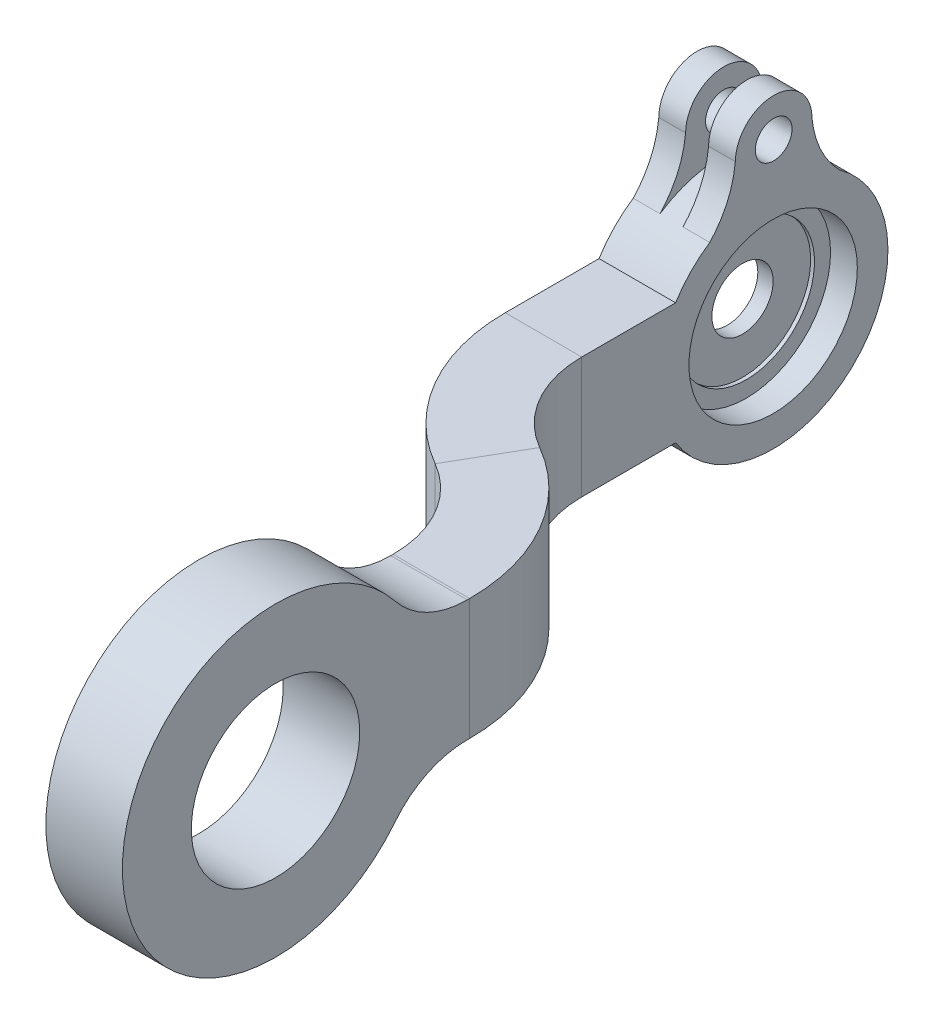
from build123d import *

# Parameters (mm, degrees)
CROQUIS2_W              = 10
CROQUIS2_H              = 15.834903248
CROQUIS4_R              = 15
SALIENTE_EXTRUIR1_DEPTH = 10
CROQUIS5_R              = 20
SALIENTE_EXTRUIR2_DEPTH = 10
SALIENTE_EXTRUIR5_DEPTH = 3.5
CROQUIS13_R             = 2.4
CORTAR_EXTRUIR1_DEPTH   = 10
CROQUIS7_R              = 11
CORTAR_EXTRUIR3_DEPTH   = 10
REDONDEO2_R             = 12
REDONDEO3_R             = 12
CROQUIS14_R             = 11
CORTAR_EXTRUIR4_DEPTH   = 4
CROQUIS6_R              = 4
CORTAR_EXTRUIR5_DEPTH   = 6
CORTAR_EXTRUIR6_START   = -4
CROQUIS15_R             = 11
CORTAR_EXTRUIR6_DEPTH   = 4
SALIENTE_EXTRUIR6_START = 0.5
CROQUIS16_R             = 11
CROQUIS16_R_2           = 8.9
SALIENTE_EXTRUIR6_DEPTH = 0.5


with BuildPart() as part:
    # Barrer1: sweep along a path in Croquis1
    with BuildLine(Plane(origin=(0, 0, 0), x_dir=(1, 0, 0), z_dir=(0, 1, 0))) as barrer1_path:
        Line((-20, 85), (-20, 60))
        ThreePointArc((-20, 60), (-17.320508076, 50), (-10, 42.679491924))
        ThreePointArc((-10, 42.679491924), (-2.679491924, 35.358983849), (0, 25.358983849))
        Line((0, 25.358983849), (0, 0))
    # Croquis2 → Barrer1 (sweep)
    with BuildSketch(Plane.XY):
        Rectangle(CROQUIS2_W, CROQUIS2_H)
    sweep(path=barrer1_path.line)

    # Croquis4 → Saliente-Extruir1 (add)
    with BuildSketch(Plane(origin=(-15, 0, 0), x_dir=(0, 0, -1), z_dir=(1, 0, 0))):
        with Locations((85, 0)):
            Circle(CROQUIS4_R)
    extrude(amount=-SALIENTE_EXTRUIR1_DEPTH)

    # Croquis5 → Saliente-Extruir2 (add)
    with BuildSketch(Plane(origin=(5, 0, 0), x_dir=(0, 0, -1), z_dir=(1, 0, 0))):
        Circle(CROQUIS5_R)
    extrude(amount=-SALIENTE_EXTRUIR2_DEPTH)

    # Croquis12 → Saliente-Extruir5 (add)
    with BuildSketch(Plane(origin=(-15, 0, 0), x_dir=(0, 0, -1), z_dir=(1, 0, 0))):
        with BuildLine():
            ThreePointArc((90.068496439, 19.972615481), (85.068496439, 24.972615481), (80.068496439, 19.972615481))
            add(Edge.make_bspline(
                [(80.068496439, 19.972615481), (79.566731031, 15.028252388), (75.848465439, 11.643922813)],
                knots=[0, 0, 0, 1, 1, 1], degree=2))
            ThreePointArc((75.848465439, 11.643922813), (85.068496439, 14.846363713), (94.288527439, 11.643922813))
            add(Edge.make_bspline(
                [(90.068496439, 19.972615481), (90.570261847, 15.028252388), (94.288527439, 11.643922813)],
                knots=[0, 0, 0, 1, 1, 1], degree=2))
        make_face()
    saliente_extruir5 = extrude(amount=-SALIENTE_EXTRUIR5_DEPTH)

    # Simetría1: Saliente-Extruir5 across plane
    add(saliente_extruir5.mirror(Plane(origin=(-20, 0, 0), x_dir=(0, 0, 1), z_dir=(1, 0, 0))))

    # Croquis13 → Cortar-Extruir1 (cut)
    with BuildSketch(Plane(origin=(-15, 0, 0), x_dir=(0, 0, -1), z_dir=(1, 0, 0))):
        with Locations((85.068496439, 19.972615481)):
            Circle(CROQUIS13_R)
    extrude(amount=-CORTAR_EXTRUIR1_DEPTH, mode=Mode.SUBTRACT)

    # Croquis7 → Cortar-Extruir3 (cut)
    with BuildSketch(Plane(origin=(5, 0, 0), x_dir=(0, 0, -1), z_dir=(1, 0, 0))):
        Circle(CROQUIS7_R)
    extrude(amount=-CORTAR_EXTRUIR3_DEPTH, mode=Mode.SUBTRACT)

    # Redondeo2
    redondeo2_edges = [part.edges().sort_by_distance(p)[0] for p in [
        (0, 7.917451624, -18.366108999),
    ]]
    fillet(redondeo2_edges, radius=REDONDEO2_R)

    # Redondeo3
    redondeo3_edges = [part.edges().sort_by_distance(p)[0] for p in [
        (0, -7.917451624, -18.366108999),
    ]]
    fillet(redondeo3_edges, radius=REDONDEO3_R)

    # Croquis14 → Cortar-Extruir4 (cut)
    with BuildSketch(Plane.ZY.offset(25)):
        with Locations((-85, 0)):
            Circle(CROQUIS14_R)
    extrude(amount=-CORTAR_EXTRUIR4_DEPTH, mode=Mode.SUBTRACT)

    # Croquis6 → Cortar-Extruir5 (cut)
    with BuildSketch(Plane(origin=(-15, 0, 0), x_dir=(0, 0, -1), z_dir=(1, 0, 0))):
        with Locations((85, 0)):
            Circle(CROQUIS6_R)
    extrude(amount=-CORTAR_EXTRUIR5_DEPTH, mode=Mode.SUBTRACT)

    # Croquis15 → Cortar-Extruir6 (cut)
    with BuildSketch(Plane(origin=(-15, 0, 0), x_dir=(0, 0, -1), z_dir=(1, 0, 0)).offset(CORTAR_EXTRUIR6_START)):
        with Locations((85, 0)):
            Circle(CROQUIS15_R)
    extrude(amount=CORTAR_EXTRUIR6_DEPTH, mode=Mode.SUBTRACT)

    # Croquis16 → Saliente-Extruir6 (add)
    with BuildSketch(Plane.ZY.offset(21).offset(SALIENTE_EXTRUIR6_START)):
        with Locations((-85, 0)):
            Circle(CROQUIS16_R)
        with Locations((-85, 0)):
            Circle(CROQUIS16_R_2, mode=Mode.SUBTRACT)
    saliente_extruir6 = extrude(amount=-SALIENTE_EXTRUIR6_DEPTH)

    # Simetría2: Saliente-Extruir6 across plane
    add(saliente_extruir6.mirror(Plane(origin=(-20, 0, 0), x_dir=(0, 0, 1), z_dir=(1, 0, 0))))


solid = part.part
